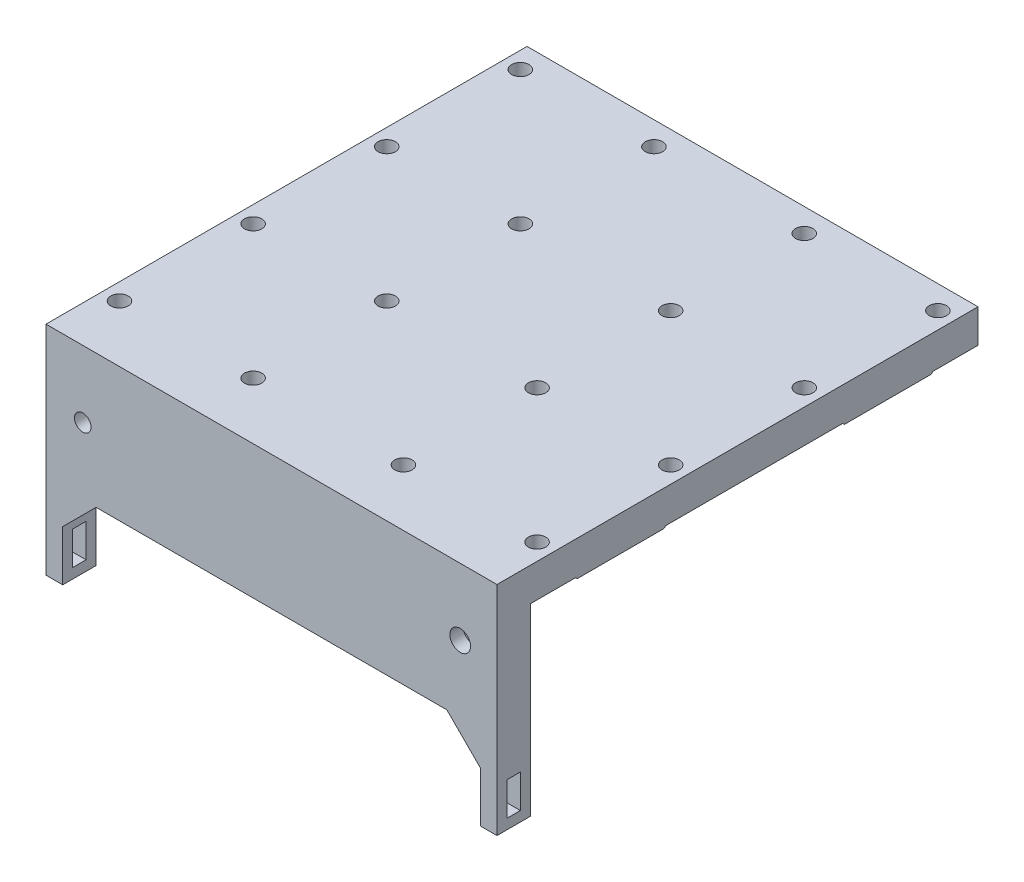
from build123d import *

# Parameters (mm, degrees)
SKETCH1_W               = 135
SKETCH1_H               = 134
BOSS_EXTRUDE1_DEPTH     = 10
SKETCH2_W               = 50
SKETCH2_H               = 27
BOSS_EXTRUDE2_DEPTH     = 0.5
CUT_EXTRUDE1_DEPTH      = 96.630800478
CUT_EXTRUDE1_DEPTH_BACK = 96.630800478
SKETCH3_R               = 2.6
BOSS_EXTRUDE3_START     = 67
SKETCH4_W               = 135
SKETCH4_H               = 40
BOSS_EXTRUDE3_DEPTH     = 10
CUT_EXTRUDE2_DEPTH      = 107.701686959
CUT_EXTRUDE2_DEPTH_BACK = 184.701686959
CUT_EXTRUDE2_START      = 77
SKETCH5_R               = 2.488859202
SKETCH5_R_2             = 3.1003276
CHAMFER1_SIZE           = 0.5
CUT_EXTRUDE3_START      = 67
SKETCH6_R               = 5.25
CUT_EXTRUDE3_DEPTH      = 6
BOSS_EXTRUDE4_START     = -67.5
SKETCH7_W               = 10
SKETCH7_H               = 25.09735907
SKETCH7_W_2             = 4
SKETCH7_H_2             = 10
BOSS_EXTRUDE4_DEPTH     = 5
BOSS_EXTRUDE5_START     = 67.5
SKETCH7_2_W             = 10
SKETCH7_2_H             = 25.09735907
SKETCH7_2_W_2           = 4
SKETCH7_2_H_2           = 10
BOSS_EXTRUDE5_DEPTH     = 5
CHAMFER2_SIZE           = 10


with BuildPart() as part:
    # Sketch1 → Boss-Extrude1 (new body)
    with BuildSketch(Plane(origin=(0, 0, 0), x_dir=(1, 0, 0), z_dir=(0, 1, 0))):
        Rectangle(SKETCH1_W, SKETCH1_H)
    extrude(amount=BOSS_EXTRUDE1_DEPTH)

    # Sketch2 → Boss-Extrude2 (add)
    with BuildSketch(Plane(origin=(0, 0, 0), x_dir=(1, 0, 0), z_dir=(0, 1, 0))):
        with Locations((-42.5, 40)):
            Rectangle(SKETCH2_W, SKETCH2_H)
        with Locations((-42.5, -40)):
            Rectangle(SKETCH2_W, SKETCH2_H)
        with Locations((42.5, -40)):
            Rectangle(SKETCH2_W, SKETCH2_H)
        with Locations((42.5, 40)):
            Rectangle(SKETCH2_W, SKETCH2_H)
    extrude(amount=-BOSS_EXTRUDE2_DEPTH)

    # Sketch3 → Cut-Extrude1 (cut, two sides: drawn at the far end of the back side and taken through both)
    with BuildSketch(Plane(origin=(0, 0, 0), x_dir=(1, 0, 0), z_dir=(0, 1, 0)).offset(-CUT_EXTRUDE1_DEPTH_BACK)):
        with Locations(Location((-62.5, 20, 0), (0, 0, 270))):
            Circle(SKETCH3_R)
        with Locations(Location((-22.5, 20, 0), (0, 0, 270))):
            Circle(SKETCH3_R)
        with Locations(Location((-22.5, 60, 0), (0, 0, 270))):
            Circle(SKETCH3_R)
        with Locations(Location((-62.5, 60, 0), (0, 0, 270))):
            Circle(SKETCH3_R)
        with Locations(Location((-62.5, -60, 0), (0, 0, 90))):
            Circle(SKETCH3_R)
        with Locations(Location((-22.5, -60, 0), (0, 0, 90))):
            Circle(SKETCH3_R)
        with Locations(Location((-22.5, -20, 0), (0, 0, 90))):
            Circle(SKETCH3_R)
        with Locations(Location((-62.5, -20, 0), (0, 0, 90))):
            Circle(SKETCH3_R)
        with Locations(Location((62.5, -20, 0), (0, 0, 270))):
            Circle(SKETCH3_R)
        with Locations(Location((22.5, -20, 0), (0, 0, 270))):
            Circle(SKETCH3_R)
        with Locations(Location((22.5, -60, 0), (0, 0, 270))):
            Circle(SKETCH3_R)
        with Locations(Location((62.5, -60, 0), (0, 0, 270))):
            Circle(SKETCH3_R)
        with Locations(Location((62.5, 60, 0), (0, 0, 90))):
            Circle(SKETCH3_R)
        with Locations(Location((22.5, 60, 0), (0, 0, 90))):
            Circle(SKETCH3_R)
        with Locations(Location((22.5, 20, 0), (0, 0, 90))):
            Circle(SKETCH3_R)
        with Locations(Location((62.5, 20, 0), (0, 0, 90))):
            Circle(SKETCH3_R)
    extrude(amount=CUT_EXTRUDE1_DEPTH + CUT_EXTRUDE1_DEPTH_BACK, mode=Mode.SUBTRACT)

    # Sketch4 → Boss-Extrude3 (add)
    with BuildSketch(Plane.XY.offset(BOSS_EXTRUDE3_START)):
        with Locations((0, -10)):
            Rectangle(SKETCH4_W, SKETCH4_H)
    extrude(amount=BOSS_EXTRUDE3_DEPTH)

    # Sketch5 → Cut-Extrude2 (cut, two sides: drawn at the far end of the back side and taken through both)
    with BuildSketch(Plane.XY.offset(CUT_EXTRUDE2_START - CUT_EXTRUDE2_DEPTH_BACK)):
        with Locations((-56.5, -10)):
            Circle(SKETCH5_R)
        with Locations((56.5, -10)):
            Circle(SKETCH5_R_2)
    extrude(amount=CUT_EXTRUDE2_DEPTH + CUT_EXTRUDE2_DEPTH_BACK, mode=Mode.SUBTRACT)

    # Chamfer1
    chamfer1_edges = [part.edges().sort_by_distance(p)[0] for p in [
        (42.5, -0.5, 26.5),
        (42.5, -0.5, 53.5),
        (-42.5, -0.5, 53.5),
        (-42.5, -0.5, 26.5),
        (-42.5, -0.5, -53.5),
        (-42.5, -0.5, -26.5),
        (42.5, -0.5, -26.5),
        (42.5, -0.5, -53.5),
    ]]
    chamfer(chamfer1_edges, length=CHAMFER1_SIZE - 0.0001)  # a hair under: the kernel refuses the full size

    # Sketch6 → Cut-Extrude3 (cut)
    with BuildSketch(Plane.XY.offset(CUT_EXTRUDE3_START)):
        with Locations((56.5, -10)):
            Circle(SKETCH6_R)
        with Locations((-56.5, -10)):
            Circle(SKETCH6_R)
    extrude(amount=CUT_EXTRUDE3_DEPTH, mode=Mode.SUBTRACT)

    # Sketch7 → Boss-Extrude4 (add)
    with BuildSketch(Plane(origin=(0, 0, 0), x_dir=(0, 0, -1), z_dir=(1, 0, 0)).offset(BOSS_EXTRUDE4_START)):
        with Locations((-72, -42.548679535)):
            Rectangle(SKETCH7_W, SKETCH7_H)
        with Locations((-72, -47.09735907)):
            Rectangle(SKETCH7_W_2, SKETCH7_H_2, mode=Mode.SUBTRACT)
    extrude(amount=BOSS_EXTRUDE4_DEPTH)

    # Sketch7<2> → Boss-Extrude5 (add)
    with BuildSketch(Plane(origin=(0, 0, 0), x_dir=(0, 0, -1), z_dir=(1, 0, 0)).offset(BOSS_EXTRUDE5_START)):
        with Locations((-72, -42.548679535)):
            Rectangle(SKETCH7_2_W, SKETCH7_2_H)
        with Locations((-72, -47.09735907)):
            Rectangle(SKETCH7_2_W_2, SKETCH7_2_H_2, mode=Mode.SUBTRACT)
    extrude(amount=-BOSS_EXTRUDE5_DEPTH)

    # Chamfer2
    chamfer2_edges = [part.edges().sort_by_distance(p)[0] for p in [
        (-62.5, -30, 72),
        (62.5, -30, 72),
    ]]
    chamfer(chamfer2_edges, length=CHAMFER2_SIZE)


solid = part.part
